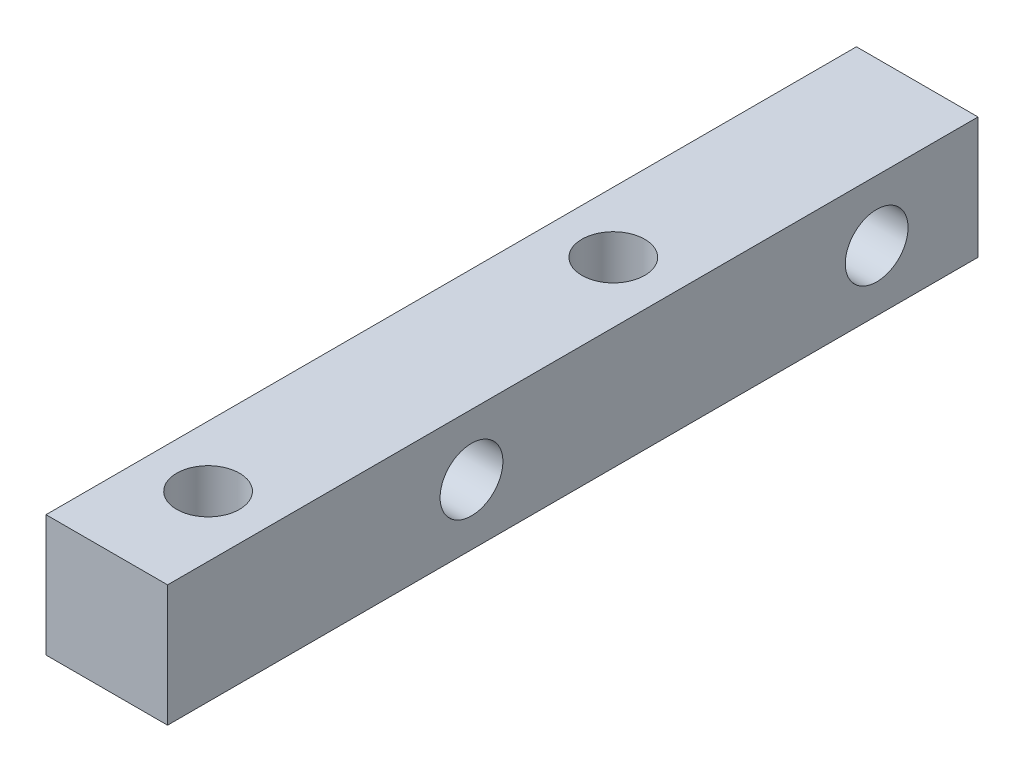
from build123d import *

# Parameters (mm, degrees)
SKETCH_2_W          = 6
SKETCH_2_H          = 6
EXTRUDE_1_DEPTH     = 40
SKETCH_3_R          = 1.55
CUT_EXTRUDE_1_DEPTH = 40
SKETCH_4_R          = 1.55
CUT_EXTRUDE_2_DEPTH = 40


with BuildPart() as part:
    # 草图2 → 凸台-拉伸1 (new body)
    with BuildSketch(Plane.XY):
        with Locations((3, 3)):
            Rectangle(SKETCH_2_W, SKETCH_2_H)
    extrude(amount=EXTRUDE_1_DEPTH)

    # 草图3 → 切除-拉伸1 (cut)
    with BuildSketch(Plane(origin=(0, 6, 0), x_dir=(1, 0, 0), z_dir=(0, 1, 0))):
        with Locations((3, -35)):
            Circle(SKETCH_3_R)
        with Locations((3, -15)):
            Circle(SKETCH_3_R)
    extrude(amount=-CUT_EXTRUDE_1_DEPTH, mode=Mode.SUBTRACT)

    # 草图4 → 切除-拉伸2 (cut)
    with BuildSketch(Plane.ZY):
        with Locations((5, 3)):
            Circle(SKETCH_4_R)
        with Locations((25, 3)):
            Circle(SKETCH_4_R)
    extrude(amount=-CUT_EXTRUDE_2_DEPTH, mode=Mode.SUBTRACT)


solid = part.part
